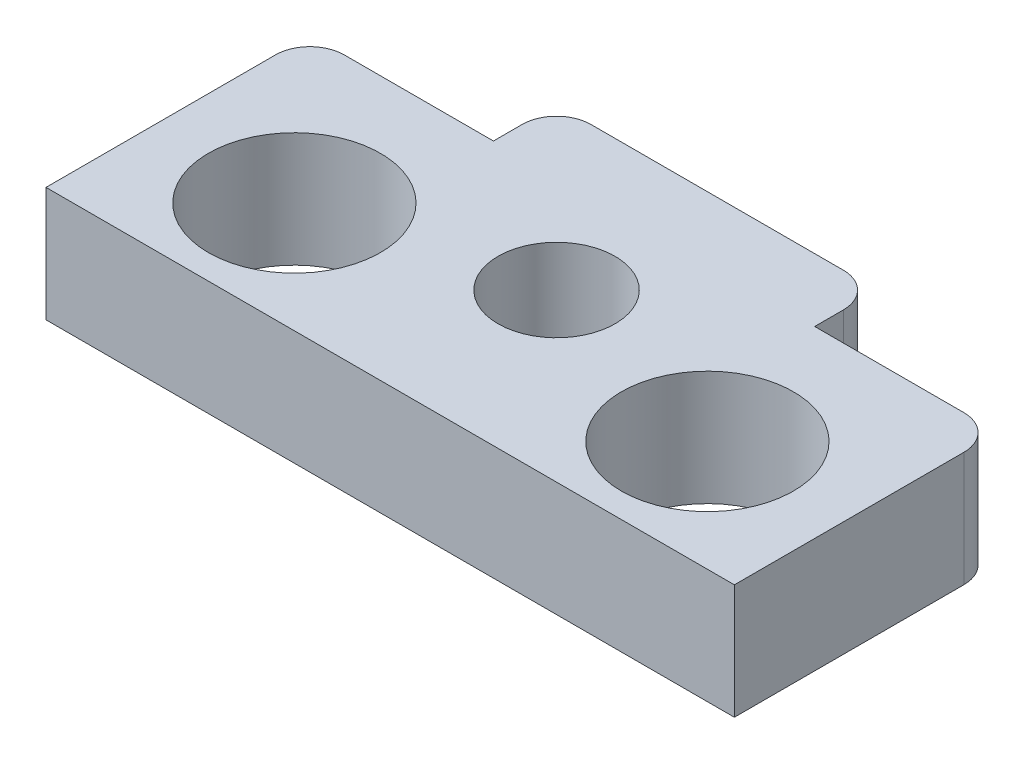
from build123d import *

# Parameters (mm, degrees)
EXTRUDE_1_DEPTH     = 10
SKETCH_3_R          = 5.1
SKETCH_3_R_2        = 7.5
CUT_EXTRUDE_2_DEPTH = 43.570529712
FILLET_2_R          = 3


with BuildPart() as part:
    # 草图1 → 凸台-拉伸1 (new body)
    with BuildSketch(Plane(origin=(0, 0, 0), x_dir=(1, 0, 0), z_dir=(0, 1, 0))):
        Polygon((0, 0), (-30, 0), (-30, 23), (-14, 23), (-14, 28.5), (14, 28.5), (14, 23), (30, 23), (30, 0), align=None)
    extrude(amount=EXTRUDE_1_DEPTH)

    # 草图3 → 切除-拉伸2 (cut, through all)
    with BuildSketch(Plane(origin=(0, 10, 0), x_dir=(1, 0, 0), z_dir=(0, 1, 0))):
        with Locations((0, 14.5)):
            Circle(SKETCH_3_R)
        with Locations((-18, 9.65)):
            Circle(SKETCH_3_R_2)
        with Locations((18, 9.65)):
            Circle(SKETCH_3_R_2)
    extrude(amount=-CUT_EXTRUDE_2_DEPTH, mode=Mode.SUBTRACT)

    # 圆角2
    fillet_2_edges = [part.edges().sort_by_distance(p)[0] for p in [
        (30, 5, -23),
        (14, 5, -28.5),
        (-14, 5, -28.5),
        (-30, 5, -23),
    ]]
    fillet(fillet_2_edges, radius=FILLET_2_R)


solid = part.part
